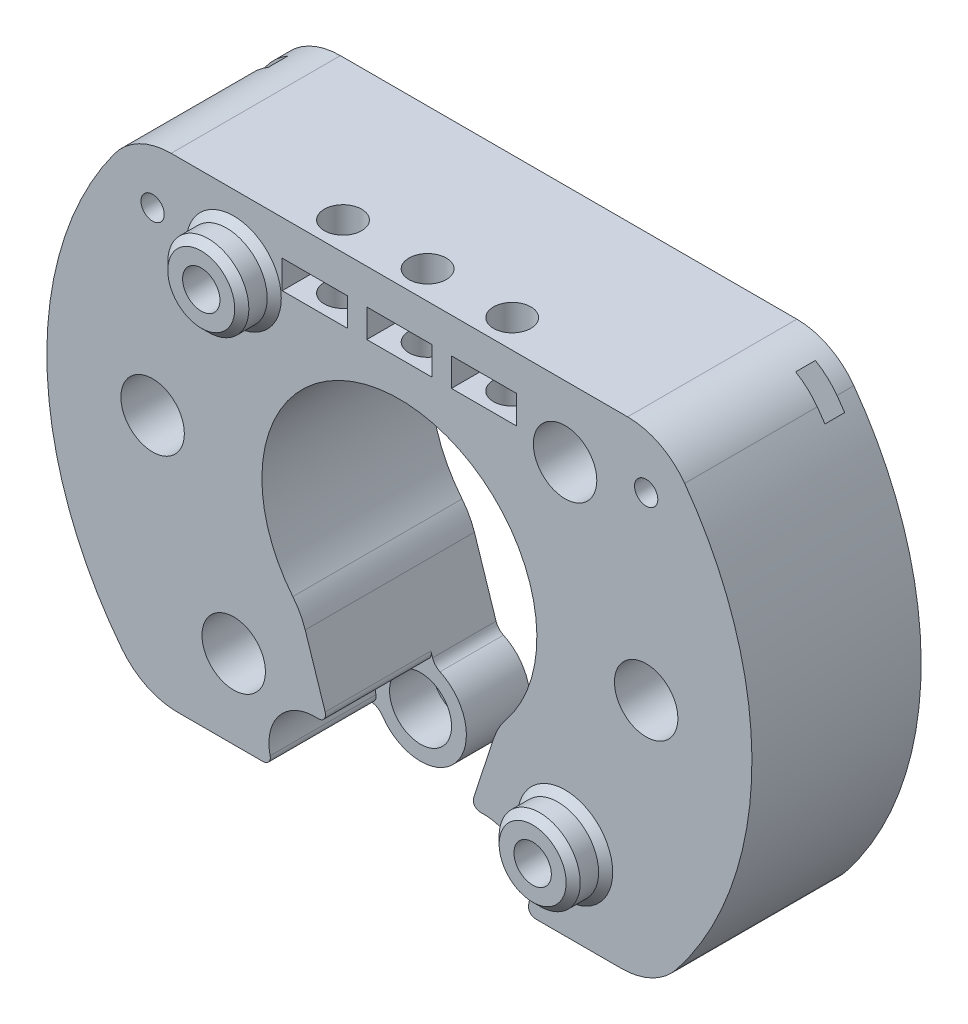
from build123d import *

# Parameters (mm, degrees)
SKIZZE1_R                            = 4.5
AUFSATZ_LINEAR_AUSTRAGEN1_DEPTH      = 24
SCHNITT_LINEAR_START                 = -15
SKIZZE2_R                            = 6.5
SCHNITT_LINEAR_AUSTRAGEN1_DEPTH      = 15
SKIZZE3_R                            = 4.4
SCHNITT_LINEAR_AUSTRAGEN2_DEPTH      = 6
AUFSATZ_LINEAR_AUSTRAGEN2_DEPTH      = 4.6
AUFSATZ_LINEAR_AUSTRAGEN2_DEPTH_BACK = 2
SKIZZE4_R                            = 5.75
SKIZZE4_R_2                          = 2.65
SCHNITT_LINEAR_START_2               = -5
SCHNITT_LINEAR_AUSTRAGEN6_DEPTH      = 4
SKIZZE9_R                            = 2.65
SCHNITT_LINEAR_AUSTRAGEN7_DEPTH      = 30
SCHNITT_LINEAR_AUSTRAGEN9_REACH      = 71.284
SKIZZE12_R                           = 1.65
SCHNITT_LINEAR_START_3               = -2.4
SCHNITT_LINEAR_AUSTRAGEN8_DEPTH      = 2.8
SCHNITT_LINEAR_AUSTRAGEN10_REACH     = 69.515
SKIZZE13_R                           = 4.5
FASE1_SIZE                           = 1
VERRUNDUNG1_R                        = 10
VERRUNDUNG2_R                        = 1
VERRUNDUNG4_R                        = 2
SCHNITT_LINEAR_AUSTRAGEN11_DEPTH     = 0.2
SKIZZE18_W                           = 5.3
SKIZZE18_H                           = 5.3
SCHNITT_LINEAR_AUSTRAGEN14_DEPTH     = 0.2
SCHNITT_LINEAR_AUSTRAGEN15_DEPTH     = 0.2
SCHNITT_LINEAR_AUSTRAGEN16_DEPTH     = 0.2


with BuildPart() as part:
    # Skizze1 → Aufsatz-Linear austragen1 (new body)
    with BuildSketch(Plane.XY):
        with BuildLine():
            Line((37.118054906, 33.5), (0, 33.5))
            Line((0, 33.5), (-37.118054906, 33.5))
            ThreePointArc((-37.118054906, 33.5), (-49.993282209, -0.819593803), (-36, -34.698703146))
            Line((-36, -34.698703146), (-17.913290229, -34.698703146))
            ThreePointArc((-17.913290229, -34.698703146), (-7.146445801, -36.323541562), (-10, -25.815341562))
            Line((-10, -25.815341562), (-14, -13.57387196))
            ThreePointArc((-14, -13.57387196), (-7.322909258, 18.072769572), (19.5, 0))
            ThreePointArc((19.5, 0), (18.072769572, -7.322909258), (14, -13.57387196))
            Line((14, -13.57387196), (10, -25.815341562))
            ThreePointArc((10, -25.815341562), (7.146445801, -36.323541562), (17.913290229, -34.698703146))
            Line((17.913290229, -34.698703146), (36, -34.698703146))
            ThreePointArc((36, -34.698703146), (49.993282209, -0.819593803), (37.118054906, 33.5))
        make_face()
        with Locations((-23.5, -23.5)):
            Circle(SKIZZE1_R, mode=Mode.SUBTRACT)
        with Locations((23.5, -23.5)):
            Circle(SKIZZE1_R, mode=Mode.SUBTRACT)
        with Locations((-23.5, 23.5)):
            Circle(SKIZZE1_R, mode=Mode.SUBTRACT)
        with Locations((23.5, 23.5)):
            Circle(SKIZZE1_R, mode=Mode.SUBTRACT)
    extrude(amount=AUFSATZ_LINEAR_AUSTRAGEN1_DEPTH)

    # Skizze2 → Schnitt-Linear austragen1 (cut)
    with BuildSketch(Plane.XY.offset(24).offset(SCHNITT_LINEAR_START)):
        with Locations((12, -32)):
            Circle(SKIZZE2_R)
        with Locations((-12, -32)):
            Circle(SKIZZE2_R)
    extrude(amount=SCHNITT_LINEAR_AUSTRAGEN1_DEPTH, mode=Mode.SUBTRACT)

    # Skizze3 → Schnitt-Linear austragen2 (cut)
    with BuildSketch(Plane.XY.offset(9)):
        with Locations((12, -32)):
            Circle(SKIZZE3_R)
        with Locations((-12, -32)):
            Circle(SKIZZE3_R)
    extrude(amount=-SCHNITT_LINEAR_AUSTRAGEN2_DEPTH, mode=Mode.SUBTRACT)

    # Skizze4 → Aufsatz-Linear austragen2 (add, two sides: drawn at the far end of the back side and taken through both)
    # profile 1 of 2: a face of its own
    with BuildSketch(Plane.XY.offset(24).offset(-AUFSATZ_LINEAR_AUSTRAGEN2_DEPTH_BACK)):
        with Locations((-23.5, 23.5)):
            Circle(SKIZZE4_R)
        with Locations((-23.5, 23.5)):
            Circle(SKIZZE4_R_2, mode=Mode.SUBTRACT)
    # profile 2 of 2: a face of its own
    with BuildSketch(Plane.XY.offset(24).offset(-AUFSATZ_LINEAR_AUSTRAGEN2_DEPTH_BACK)):
        with Locations((23.5, -23.5)):
            Circle(SKIZZE4_R)
        with Locations((23.5, -23.5)):
            Circle(SKIZZE4_R_2, mode=Mode.SUBTRACT)
    extrude(amount=AUFSATZ_LINEAR_AUSTRAGEN2_DEPTH + AUFSATZ_LINEAR_AUSTRAGEN2_DEPTH_BACK)

    # Skizze8 → Schnitt-Linear austragen6 (cut)
    with BuildSketch(Plane(origin=(0, 33.5, 0), x_dir=(1, 0, 0), z_dir=(0, 1, 0)).offset(SCHNITT_LINEAR_START_2)):
        Polygon((4.618802154, -20), (2.309401077, -16), (-2.309401077, -16), (-4.618802154, -20), (-4.618802154, -24), (4.618802154, -24), align=None)
        Polygon((16.618802154, -20), (14.309401077, -16), (9.690598923, -16), (7.381197846, -20), (7.381197846, -24), (16.618802154, -24), align=None)
        Polygon((-7.381197846, -20), (-9.690598923, -16), (-14.309401077, -16), (-16.618802154, -20), (-16.618802154, -24), (-7.381197846, -24), align=None)
    extrude(amount=-SCHNITT_LINEAR_AUSTRAGEN6_DEPTH, mode=Mode.SUBTRACT)

    # Skizze9 → Schnitt-Linear austragen7 (cut)
    with BuildSketch(Plane(origin=(0, 33.5, 0), x_dir=(1, 0, 0), z_dir=(0, 1, 0))):
        with Locations(Location((-12, -20, 0), (0, 0, 180))):
            Circle(SKIZZE9_R)
        with Locations(Location((0, -20, 0), (0, 0, 180))):
            Circle(SKIZZE9_R)
        with Locations(Location((12, -20, 0), (0, 0, 180))):
            Circle(SKIZZE9_R)
    extrude(amount=-SCHNITT_LINEAR_AUSTRAGEN7_DEPTH, mode=Mode.SUBTRACT)

    # Skizze12 → Schnitt-Linear austragen9 (cut, up to next)
    with BuildSketch(Plane(origin=(0, 0, 0), x_dir=(-1, 0, 0), z_dir=(0, 0, -1)), mode=Mode.PRIVATE) as schnitt_linear_austragen9_sk1:
        with Locations((-35, 25.5)):
            Circle(SKIZZE12_R)
    schnitt_linear_austragen9_tool1 = extrude(schnitt_linear_austragen9_sk1.sketch, amount=-SCHNITT_LINEAR_AUSTRAGEN9_REACH, mode=Mode.PRIVATE) & part.part
    # Skizze12 → Schnitt-Linear austragen9 (cut, up to next)
    with BuildSketch(Plane(origin=(0, 0, 0), x_dir=(-1, 0, 0), z_dir=(0, 0, -1)), mode=Mode.PRIVATE) as schnitt_linear_austragen9_sk2:
        with Locations((35, 25.5)):
            Circle(SKIZZE12_R)
    schnitt_linear_austragen9_tool2 = extrude(schnitt_linear_austragen9_sk2.sketch, amount=-SCHNITT_LINEAR_AUSTRAGEN9_REACH, mode=Mode.PRIVATE) & part.part
    add(schnitt_linear_austragen9_tool1.solids().sort_by_distance((35, 25.5, 0))[0], mode=Mode.SUBTRACT)
    add(schnitt_linear_austragen9_tool2.solids().sort_by_distance((-35, 25.5, 0))[0], mode=Mode.SUBTRACT)

    # Skizze11 → Schnitt-Linear austragen8 (cut)
    with BuildSketch(Plane(origin=(0, 0, 0), x_dir=(-1, 0, 0), z_dir=(0, 0, -1)).offset(SCHNITT_LINEAR_START_3)):
        Polygon((-44.899494937, 39.642135624), (-30.757359313, 25.5), (-35, 21.257359313), (-49.142135624, 35.399494937), align=None)
        Polygon((44.899494937, 39.642135624), (49.142135624, 35.399494937), (35, 21.257359313), (30.757359313, 25.5), align=None)
    extrude(amount=-SCHNITT_LINEAR_AUSTRAGEN8_DEPTH, mode=Mode.SUBTRACT)

    # Skizze13 → Schnitt-Linear austragen10 (cut, up to next)
    with BuildSketch(Plane.XY.offset(24), mode=Mode.PRIVATE) as schnitt_linear_austragen10_sk1:
        with Locations((35, 0)):
            Circle(SKIZZE13_R)
    schnitt_linear_austragen10_tool1 = extrude(schnitt_linear_austragen10_sk1.sketch, amount=-SCHNITT_LINEAR_AUSTRAGEN10_REACH, mode=Mode.PRIVATE) & part.part
    # Skizze13 → Schnitt-Linear austragen10 (cut, up to next)
    with BuildSketch(Plane.XY.offset(24), mode=Mode.PRIVATE) as schnitt_linear_austragen10_sk2:
        with Locations((-35, 0)):
            Circle(SKIZZE13_R)
    schnitt_linear_austragen10_tool2 = extrude(schnitt_linear_austragen10_sk2.sketch, amount=-SCHNITT_LINEAR_AUSTRAGEN10_REACH, mode=Mode.PRIVATE) & part.part
    add(schnitt_linear_austragen10_tool1.solids().sort_by_distance((35, 0, 24))[0], mode=Mode.SUBTRACT)
    add(schnitt_linear_austragen10_tool2.solids().sort_by_distance((-35, 0, 24))[0], mode=Mode.SUBTRACT)

    # Fase1
    fase1_edges = [part.edges().sort_by_distance(p)[0] for p in [
        (-29.25, 23.5, 24),
        (-29.25, 23.5, 28.6),
        (17.75, -23.5, 24),
        (17.75, -23.5, 28.6),
    ]]
    chamfer(fase1_edges, length=FASE1_SIZE)

    # Verrundung1
    # the kernel refuses this fillet: 10 mm, written as the material it takes off along each edge
    with BuildSketch(Plane(origin=(-37.118054906, 33.5, -13.2741053), x_dir=(1, 0, 0), z_dir=(0, 0, 1))) as verrundung1_piece_1:
        with BuildLine():
            CenterArc((4.749088287, -10), VERRUNDUNG1_R, 90, 54.020199403)
            ThreePointArc((-3.343153368, -4.125), (-1.726371015, -2.018091308), (0, 0))
            Line((0, 0), (4.749088287, 0))
        make_face()
    extrude(amount=50.5482106, mode=Mode.SUBTRACT)
    with BuildSketch(Plane(origin=(37.118054906, 33.5, -13.2741053), x_dir=(0.6296381738302621, -0.7768885184218471, 0), z_dir=(0, 0, 1))) as verrundung1_piece_2:
        with BuildLine():
            CenterArc((4.778677908, -9.985893901), VERRUNDUNG1_R, 86.956367897, 54.020199403)
            Line((-2.990207276, -3.689512163), (0, 0))
            ThreePointArc((0, 0), (2.65482106, 0.070530494), (5.30964212, 0))
        make_face()
    extrude(amount=50.5482106, mode=Mode.SUBTRACT)
    with BuildSketch(Plane(origin=(36, -34.698703146, -12.678915541), x_dir=(-1, 0, 0), z_dir=(0, 0, 1))) as verrundung1_piece_3:
        with BuildLine():
            CenterArc((4.536146725, -10), VERRUNDUNG1_R, 90, 51.86856143)
            ThreePointArc((-3.329816594, -3.825324214), (-1.713440487, -1.870416461), (0, 0))
            Line((0, 0), (4.536146725, 0))
        make_face()
    extrude(amount=49.357831082, mode=Mode.SUBTRACT)
    with BuildSketch(Plane(origin=(-36, -34.698703146, -12.678915541), x_dir=(1, 0, 0), z_dir=(0, 0, 1))) as verrundung1_piece_4:
        with BuildLine():
            CenterArc((4.536146725, 10), VERRUNDUNG1_R, 218.13143857, 51.86856143)
            ThreePointArc((-3.329816594, 3.825324214), (-1.713440487, 1.870416461), (0, 0))
            Line((0, 0), (4.536146725, 0))
        make_face()
    extrude(amount=49.357831082, mode=Mode.SUBTRACT)
    with BuildSketch(Plane(origin=(14, -13.57387196, -5.154878876), x_dir=(0.6645913450813038, 0.7472070289036522, 0), z_dir=(0, 0, 1))) as verrundung1_piece_5:
        with BuildLine():
            CenterArc((2.106280598, -9.99075704), VERRUNDUNG1_R, 92.46363641, 21.092120115)
            Line((-1.890132434, -0.824041005), (0, 0))
            ThreePointArc((0, 0), (0.838213707, -0.018023771), (1.676427414, 0))
        make_face()
    extrude(amount=34.309757752, mode=Mode.SUBTRACT)
    with BuildSketch(Plane(origin=(-14, -13.57387196, -5.154878876), x_dir=(-0.6645913450813035, 0.7472070289036524, 0), z_dir=(0, 0, 1))) as verrundung1_piece_6:
        with BuildLine():
            CenterArc((2.106280598, 9.99075704), VERRUNDUNG1_R, 246.444243475, 21.092120115)
            Line((-1.890132434, 0.824041005), (0, 0))
            ThreePointArc((0, 0), (0.838213707, 0.018023771), (1.676427414, 0))
        make_face()
    extrude(amount=34.309757752, mode=Mode.SUBTRACT)

    # Verrundung2
    verrundung2_edges = [part.edges().sort_by_distance(p)[0] for p in [
        (-10, -25.815341562, 16.5),
        (-17.913290229, -34.698703146, 16.5),
        (17.913290229, -34.698703146, 16.5),
        (10, -25.815341562, 16.5),
    ]]
    fillet(verrundung2_edges, radius=VERRUNDUNG2_R)

    # Verrundung4
    verrundung4_edges = [part.edges().sort_by_distance(p)[0] for p in [
        (-10, -25.815341562, 4.5),
        (-17.913290229, -34.698703146, 4.5),
        (17.913290229, -34.698703146, 4.5),
        (10, -25.815341562, 4.5),
    ]]
    fillet(verrundung4_edges, radius=VERRUNDUNG4_R)

    # Skizze14 → Schnitt-Linear austragen11 (cut)
    with BuildSketch(Plane(origin=(0, 0, 22), x_dir=(-1, 0, 0), z_dir=(0, 0, -1))):
        with BuildLine():
            Line((-26.15, -19.863036981), (-26.15, -27.136963019))
            ThreePointArc((-26.15, -27.136963019), (-23.5, -28), (-20.85, -27.136963019))
            Line((-20.85, -27.136963019), (-20.85, -19.863036981))
            ThreePointArc((-20.85, -19.863036981), (-23.5, -19), (-26.15, -19.863036981))
        make_face()
        with BuildLine():
            Line((20.85, 27.136963019), (20.85, 19.863036981))
            ThreePointArc((20.85, 19.863036981), (23.5, 19), (26.15, 19.863036981))
            Line((26.15, 19.863036981), (26.15, 27.136963019))
            ThreePointArc((26.15, 27.136963019), (23.5, 28), (20.85, 27.136963019))
        make_face()
    extrude(amount=-SCHNITT_LINEAR_AUSTRAGEN11_DEPTH, mode=Mode.SUBTRACT)

    # Skizze18 → Schnitt-Linear austragen14 (cut)
    with BuildSketch(Plane(origin=(0, 0, 22.2), x_dir=(-1, 0, 0), z_dir=(0, 0, -1))):
        with Locations((-23.5, -23.5)):
            Rectangle(SKIZZE18_W, SKIZZE18_H)
        with Locations((23.5, 23.5)):
            Rectangle(SKIZZE18_W, SKIZZE18_H)
    extrude(amount=-SCHNITT_LINEAR_AUSTRAGEN14_DEPTH, mode=Mode.SUBTRACT)

    # Skizze19 → Schnitt-Linear austragen15 (cut)
    with BuildSketch(Plane(origin=(0, 0, 5.2), x_dir=(-1, 0, 0), z_dir=(0, 0, -1))):
        Polygon((-31.711953467, 26.454594155), (-35.954594155, 22.211953467), (-38.288046533, 24.545405845), (-34.045405845, 28.788046533), align=None)
        Polygon((34.045405845, 28.788046533), (31.711953467, 26.454594155), (35.954594155, 22.211953467), (38.288046533, 24.545405845), align=None)
    extrude(amount=-SCHNITT_LINEAR_AUSTRAGEN15_DEPTH, mode=Mode.SUBTRACT)

    # Skizze20 → Schnitt-Linear austragen16 (cut)
    with BuildSketch(Plane(origin=(0, 0, 5.4), x_dir=(-1, 0, 0), z_dir=(0, 0, -1))):
        Polygon((-35, 27.833452378), (-37.333452378, 25.5), (-35, 23.166547622), (-32.666547622, 25.5), align=None)
        Polygon((35, 23.166547622), (32.666547622, 25.5), (35, 27.833452378), (37.333452378, 25.5), align=None)
    extrude(amount=-SCHNITT_LINEAR_AUSTRAGEN16_DEPTH, mode=Mode.SUBTRACT)


solid = part.part
